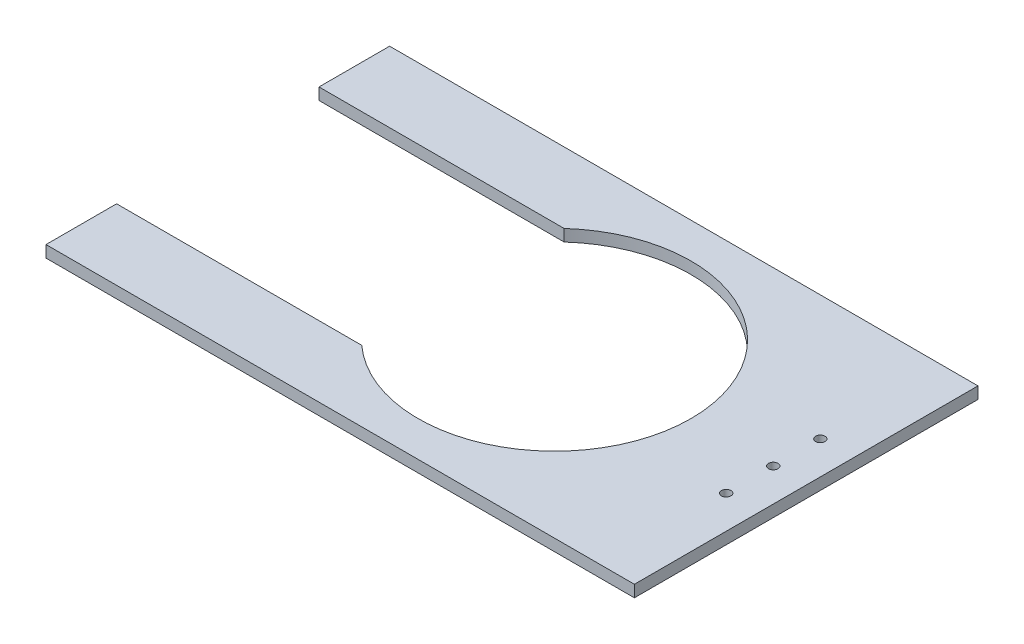
from build123d import *

# Parameters (mm, degrees)
SKETCH1_R           = 2
BOSS_EXTRUDE1_DEPTH = 5


with BuildPart() as part:
    # Sketch1 → Boss-Extrude1 (new body)
    with BuildSketch(Plane(origin=(0, 0, 0), x_dir=(1, 0, 0), z_dir=(0, 1, 0))):
        with BuildLine():
            Line((-228.663769869, 10), (-118.663769869, 10))
            Line((-118.663769869, 10), (21.336230131, 10))
            Line((21.336230131, 10), (21.336230131, -106))
            Line((21.336230131, -106), (21.336230131, -136))
            Line((21.336230131, -136), (-118.663769869, -136))
            Line((-118.663769869, -136), (-228.663769869, -136))
            Line((-228.663769869, -136), (-228.663769869, -106))
            Line((-228.663769869, -106), (-124.517389937, -106))
            ThreePointArc((-124.517389937, -106), (-27.594389025, -63), (-124.517389937, -20))
            Line((-124.517389937, -20), (-228.663769869, -20))
            Line((-228.663769869, -20), (-228.663769869, 10))
        make_face()
        with Locations((7.336230131, -63)):
            Circle(SKETCH1_R, mode=Mode.SUBTRACT)
        with Locations((7.336230131, -43)):
            Circle(SKETCH1_R, mode=Mode.SUBTRACT)
        with Locations((7.336230131, -83)):
            Circle(SKETCH1_R, mode=Mode.SUBTRACT)
    extrude(amount=BOSS_EXTRUDE1_DEPTH)


solid = part.part
